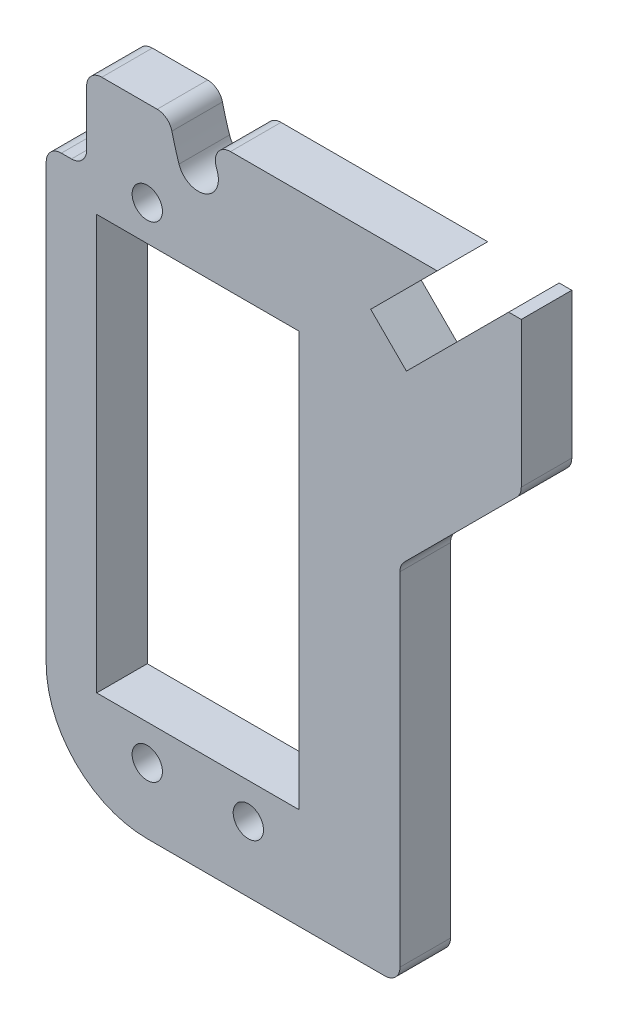
from build123d import *

# Parameters (mm, degrees)
ESQUISSE1_R        = 1.5
BOSS_EXTRU_1_DEPTH = 5
CONG_2_R           = 10
CONG_4_R           = 1.5


with BuildPart() as part:
    # Esquisse1 → Boss.-Extru.1 (new body)
    with BuildSketch(Plane.XY):
        with BuildLine():
            Line((0, 54.5), (0, 0))
            Line((0, 0), (35, 0))
            Line((35, 0), (35, 36))
            Line((35, 36), (47, 48))
            Line((47, 48), (47, 63))
            Line((47, 63), (45.752159395, 63))
            Line((45.752159395, 63), (35.639535665, 52.88737627))
            Line((35.639535665, 52.88737627), (32.104001759, 56.422910176))
            Line((32.104001759, 56.422910176), (38.681091584, 63))
            Line((38.681091584, 63), (16.273544028, 63))
            ThreePointArc((16.273544028, 63), (16.579779278, 61.804862269), (16.938867642, 60.624527668))
            ThreePointArc((16.938867642, 60.624527668), (15.66340447, 58.10000916), (13.138885962, 59.375472332))
            ThreePointArc((13.138885962, 59.375472332), (12.662086125, 60.964996741), (12.269037246, 62.57727417))
            ThreePointArc((12.269037246, 62.57727417), (12.235180806, 62.787433079), (12.22385255, 63))
            Line((12.22385255, 63), (4, 63))
            Line((4, 63), (4, 54.5))
            Line((4, 54.5), (0, 54.5))
        make_face()
        with Locations((10, 6.5)):
            Circle(ESQUISSE1_R, mode=Mode.SUBTRACT)
        with Locations((20, 6.5)):
            Circle(ESQUISSE1_R, mode=Mode.SUBTRACT)
        Polygon((5, 51), (15, 51), (25, 51), (25, 10), (5, 10), align=None, mode=Mode.SUBTRACT)
        with Locations((10, 54.5)):
            Circle(ESQUISSE1_R, mode=Mode.SUBTRACT)
    extrude(amount=BOSS_EXTRU_1_DEPTH)

    # Congé2
    cong_2_edges = [part.edges().sort_by_distance(p)[0] for p in [
        (0, 0, 2.5),
    ]]
    fillet(cong_2_edges, radius=CONG_2_R)

    # Congé4
    cong_4_edges = [part.edges().sort_by_distance(p)[0] for p in [
        (0, 54.5, 2.5),
        (4, 54.5, 2.5),
        (47, 48, 2.5),
        (35, 36, 2.5),
        (35, 0, 2.5),
        (16.273544028, 63, 2.5),
        (12.22385255, 63, 2.5),
        (4, 63, 2.5),
    ]]
    fillet(cong_4_edges, radius=CONG_4_R)


solid = part.part
